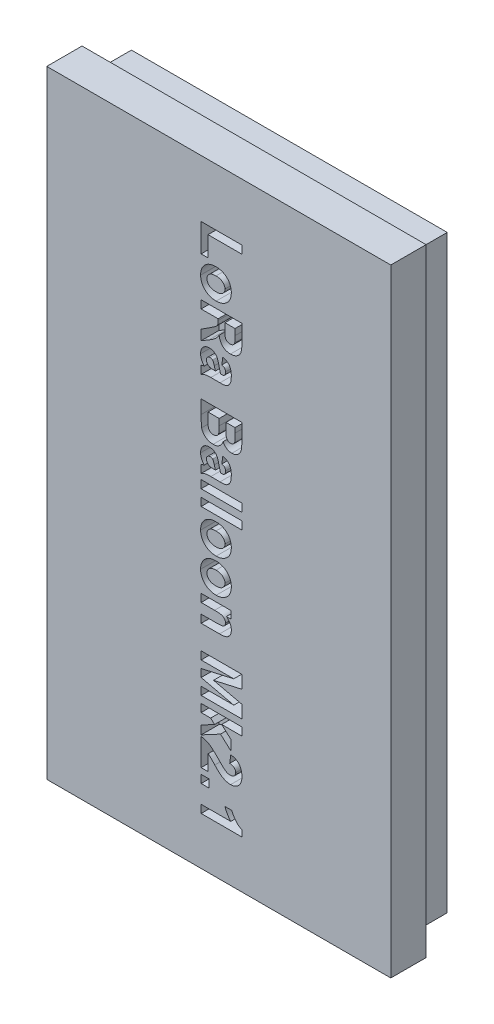
from build123d import *

# Parameters (mm, degrees)
SKETCH1_W           = 39
SKETCH1_H           = 70
BOSS_EXTRUDE1_DEPTH = 4
SKETCH2_W           = 35.8
SKETCH2_H           = 66.8
SKETCH2_W_2         = 32.2
SKETCH2_H_2         = 63.2
BOSS_EXTRUDE2_DEPTH = 4
SKETCH3_W           = 4.622973633
SKETCH3_H           = 0.90057928
SKETCH3_H_2         = 0.900579279
SKETCH3_W_2         = 0.900579279
CUT_EXTRUDE1_DEPTH  = 2


with BuildPart() as part:
    # Sketch1 → Boss-Extrude1 (new body)
    with BuildSketch(Plane.XY):
        with Locations((19.5, 35)):
            Rectangle(SKETCH1_W, SKETCH1_H)
    extrude(amount=BOSS_EXTRUDE1_DEPTH)

    # Sketch2 → Boss-Extrude2 (add)
    with BuildSketch(Plane(origin=(0, 0, 0), x_dir=(-1, 0, 0), z_dir=(0, 0, -1))):
        with Locations((-19.5, 35)):
            Rectangle(SKETCH2_W, SKETCH2_H)
        with Locations((-19.5, 35)):
            Rectangle(SKETCH2_W_2, SKETCH2_H_2, mode=Mode.SUBTRACT)
    extrude(amount=BOSS_EXTRUDE2_DEPTH)

    # Sketch3 → Cut-Extrude1 (cut)
    # profile 1 of 16: a face of its own
    with BuildSketch(Plane.XY.offset(4)):
        Polygon((17.5, 63.519691051), (22.122973633, 63.519691051), (22.122973633, 62.619111772), (18.280502042, 62.619111772), (18.280502042, 60.337644265), (17.5, 60.337644265), align=None)
    # profile 2 of 16: a face of its own
    with BuildSketch(Plane.XY.offset(4)):
        with BuildLine():
            add(Edge.make_bspline(
                [(19.227986492, 59.917373935), (19.268340591, 59.916553667), (19.348241235, 59.914929545), (19.466831788, 59.904980589), (19.582597294, 59.885571908), (19.695714536, 59.860482277), (19.806416527, 59.82895916), (19.913363069, 59.787668503), (20.018572563, 59.741561532), (20.119538873, 59.686551332), (20.216642118, 59.627238007), (20.307982668, 59.562480077), (20.392270804, 59.492505889), (20.471764649, 59.420003428), (20.542963196, 59.340819709), (20.610173753, 59.25914226), (20.668761487, 59.17106248), (20.722741328, 59.080281515), (20.769340893, 58.984958843), (20.810963092, 58.887212626), (20.84421655, 58.785501626), (20.874003462, 58.682243794), (20.895076066, 58.575124144), (20.911226693, 58.46559476), (20.920807626, 58.352789526), (20.921733394, 58.276648926), (20.922201261, 58.23816882)],
                knots=[0, 0, 0, 0, 1.087797627, 2.153826546, 3.204146119, 4.249074796, 5.276002369, 6.302929943, 7.33671768, 8.369955531, 9.399197913, 10.402506754, 11.384561342, 12.350717656, 13.299250364, 14.252266119, 15.199037181, 16.147307724, 17.097187567, 18.056740571, 19.008264324, 19.97962709, 20.951574749, 21.948063114, 22.962987564, 24, 24, 24, 24], degree=3))
            add(Edge.make_bspline(
                [(20.922201261, 58.23816882), (20.920492435, 58.17431076), (20.917163302, 58.049902547), (20.89380331, 57.868435741), (20.853287611, 57.69781183), (20.797267351, 57.536975467), (20.72326136, 57.38733444), (20.634810544, 57.247019053), (20.529143938, 57.117967528), (20.40795289, 57.001818049), (20.277240101, 56.897040623), (20.139130934, 56.806096419), (19.996080966, 56.728621147), (19.847473094, 56.665454644), (19.693540221, 56.615077456), (19.533372162, 56.581373883), (19.368435672, 56.5582934), (19.256523789, 56.556247491), (19.199843389, 56.555211293)],
                knots=[0, 0, 0, 0, 1.136040707, 2.213233445, 3.248238065, 4.25119704, 5.236487175, 6.211911138, 7.196384178, 8.195725979, 9.1931767, 10.173001403, 11.133846892, 12.083513917, 13.042376269, 14.010298635, 14.992269034, 16, 16, 16, 16], degree=3))
            add(Edge.make_bspline(
                [(19.199843389, 56.555211293), (19.157599655, 56.555892607), (19.0738988, 56.557242549), (18.949923499, 56.569225625), (18.828866965, 56.586435452), (18.710806659, 56.612233079), (18.595913097, 56.644512826), (18.484212787, 56.68553559), (18.375843769, 56.733219222), (18.270645012, 56.787374854), (18.171228883, 56.848385325), (18.076479739, 56.912829759), (17.989613644, 56.983498286), (17.908343846, 57.057930632), (17.833120613, 57.136653742), (17.764474284, 57.22039727), (17.702322369, 57.308790164), (17.647348245, 57.401571301), (17.598380596, 57.497418925), (17.556075444, 57.596143647), (17.52061437, 57.69714263), (17.49154767, 57.800282717), (17.4673821, 57.905319168), (17.452433072, 58.013337566), (17.441007522, 58.123164342), (17.440311587, 58.197173674), (17.439961381, 58.234416407)],
                knots=[0, 0, 0, 0, 1.117558833, 2.214307803, 3.293244786, 4.351421184, 5.409597582, 6.448807362, 7.497331125, 8.540978692, 9.576922014, 10.582241184, 11.570837346, 12.537122916, 13.496974449, 14.449450387, 15.399839374, 16.353464778, 17.300823134, 18.246083241, 19.193441597, 20.131138339, 21.080698472, 22.042616426, 23.015011865, 24, 24, 24, 24], degree=3))
            add(Edge.make_bspline(
                [(17.439961381, 58.234416407), (17.441434818, 58.293581477), (17.444329398, 58.409811804), (17.466190044, 58.580403837), (17.502637169, 58.743113282), (17.553836141, 58.89819662), (17.618260134, 59.046016275), (17.698440035, 59.185734774), (17.79447105, 59.316576164), (17.902499007, 59.440250702), (18.024251963, 59.553385074), (18.159878703, 59.651084335), (18.308067385, 59.733312239), (18.468125433, 59.800916368), (18.640780217, 59.853364958), (18.825794291, 59.890561403), (19.022910429, 59.913321598), (19.158504181, 59.916000953), (19.227986492, 59.917373935)],
                knots=[0, 0, 0, 0, 1.024594995, 2.012826322, 2.973358778, 3.908543225, 4.837401023, 5.761810751, 6.69243552, 7.644223827, 8.602462928, 9.564551743, 10.532007457, 11.531954493, 12.568505162, 13.651979317, 14.796803673, 16, 16, 16, 16], degree=3))
        make_face()
        with BuildLine():
            add(Edge.make_bspline(
                [(19.181081321, 59.016794656), (19.140418132, 59.015985767), (19.061457429, 59.014415049), (18.946509384, 59.004834622), (18.839622498, 58.985121553), (18.739486697, 58.962179728), (18.647961982, 58.928237045), (18.563118232, 58.889661344), (18.486368037, 58.842211129), (18.418159022, 58.787894592), (18.358227437, 58.728430958), (18.305063926, 58.666277416), (18.260023454, 58.601076499), (18.223835025, 58.532291004), (18.195763008, 58.46081815), (18.174765469, 58.386120438), (18.162389452, 58.308317825), (18.161082475, 58.255410656), (18.160424805, 58.228787786)],
                knots=[0, 0, 0, 0, 1.347985487, 2.617548842, 3.817114289, 4.948286482, 6.017057593, 7.046407217, 8.032969353, 8.999289909, 9.930051738, 10.827140183, 11.706817169, 12.550594062, 13.397420762, 14.247349517, 15.118066881, 16, 16, 16, 16], degree=3))
            add(Edge.make_bspline(
                [(18.160424805, 58.228787786), (18.161082172, 58.202789107), (18.162388524, 58.151123318), (18.174768649, 58.075184814), (18.195758212, 58.002347429), (18.224167513, 57.93213144), (18.260561859, 57.864498818), (18.306359128, 57.800600759), (18.359147439, 57.739085743), (18.42010437, 57.68129455), (18.488357165, 57.627164406), (18.565874129, 57.581398416), (18.650982245, 57.542984668), (18.743354127, 57.51120928), (18.843361939, 57.485665346), (18.951359004, 57.468256351), (19.067059726, 57.458032174), (19.146662829, 57.456552441), (19.187648045, 57.455790572)],
                knots=[0, 0, 0, 0, 0.86498205, 1.718932724, 2.552529207, 3.383717481, 4.236080589, 5.102502034, 5.995588818, 6.930639414, 7.894730959, 8.889086482, 9.918564038, 10.998334367, 12.1369617, 13.350269694, 14.635734454, 16, 16, 16, 16], degree=3))
            add(Edge.make_bspline(
                [(19.187648045, 57.455790572), (19.227688932, 57.456588782), (19.305407142, 57.458138086), (19.418448526, 57.467853118), (19.523973479, 57.487150925), (19.622320571, 57.511914829), (19.713524667, 57.543985128), (19.797316766, 57.58327715), (19.873991238, 57.630272105), (19.942107737, 57.685034462), (20.003044034, 57.743795675), (20.055828048, 57.806243808), (20.101619145, 57.87108965), (20.138009283, 57.939653741), (20.166408615, 58.010806032), (20.187393837, 58.084578407), (20.199774112, 58.161447567), (20.201080471, 58.21373417), (20.201737837, 58.240045027)],
                knots=[0, 0, 0, 0, 1.337232047, 2.595528913, 3.783536199, 4.915617704, 5.97906533, 7.006690339, 8.000659516, 8.974235141, 9.919454987, 10.823278711, 11.700968276, 12.565199868, 13.408680491, 14.254935835, 15.121875735, 16, 16, 16, 16], degree=3))
            add(Edge.make_bspline(
                [(20.201737837, 58.240045027), (20.201125638, 58.266363218), (20.199923414, 58.318046388), (20.187117275, 58.394207937), (20.1666105, 58.467170456), (20.137959369, 58.53762355), (20.10165055, 58.605310335), (20.055496899, 58.669222471), (20.003354012, 58.731596732), (19.942036507, 58.789412202), (19.873587127, 58.843503766), (19.796542842, 58.889985729), (19.712370979, 58.929796557), (19.620397249, 58.961484494), (19.521262796, 58.98667956), (19.414268616, 59.004448634), (19.300102491, 59.014500587), (19.221439565, 59.016016772), (19.181081321, 59.016794656)],
                knots=[0, 0, 0, 0, 0.8777483, 1.723705717, 2.56959874, 3.403036217, 4.257705828, 5.126471818, 6.029908573, 6.967489424, 7.934189811, 8.936630112, 9.963815147, 11.036651848, 12.178360317, 13.374360467, 14.652907978, 16, 16, 16, 16], degree=3))
        make_face(mode=Mode.SUBTRACT)
    # profile 3 of 16: a face of its own
    with BuildSketch(Plane.XY.offset(4)):
        with BuildLine():
            Line((17.5, 55.834747869), (22.122973633, 55.834747869))
            Line((22.122973633, 55.834747869), (22.122973633, 53.931336039))
            add(Edge.make_bspline(
                [(22.122973633, 53.931336039), (22.122603462, 53.872546069), (22.121890503, 53.759314846), (22.116763364, 53.595968956), (22.105883787, 53.445890968), (22.093695487, 53.308683291), (22.075788291, 53.184747794), (22.054389036, 53.07355638), (22.02973767, 52.975250916), (21.991190656, 52.86232027), (21.927918547, 52.73590191), (21.829831137, 52.599074998), (21.709116511, 52.475953385), (21.591346034, 52.386968918), (21.487257539, 52.325280846), (21.404923358, 52.283439484), (21.317857299, 52.250098354), (21.227356033, 52.221689731), (21.133020602, 52.199279165), (21.034598303, 52.183293809), (20.932711672, 52.173783072), (20.863433738, 52.17285937), (20.828390919, 52.172392134)],
                knots=[0, 0, 0, 0, 1.403336213, 2.702867097, 3.89994726, 4.994709233, 5.990128961, 6.887471613, 7.696701944, 8.407207329, 9.732421867, 11.053910544, 12.410433107, 13.833109191, 14.562763883, 15.297137368, 16.03453921, 16.78526912, 17.560138056, 18.346710252, 19.163717375, 20, 20, 20, 20], degree=3))
            add(Edge.make_bspline(
                [(20.828390919, 52.172392134), (20.784249276, 52.173152122), (20.697885971, 52.17463904), (20.571821786, 52.19038499), (20.45195708, 52.21403639), (20.339297604, 52.249508681), (20.231984451, 52.291952276), (20.132497639, 52.347135765), (20.039105913, 52.411113631), (19.952432097, 52.48444969), (19.87351831, 52.567423037), (19.802330467, 52.658794234), (19.737810759, 52.757581763), (19.682936532, 52.865615406), (19.633581682, 52.98093702), (19.593807931, 53.105487545), (19.560681473, 53.237717693), (19.545373295, 53.32925955), (19.537560619, 53.375978817)],
                knots=[0, 0, 0, 0, 1.084141299, 2.12112686, 3.117250271, 4.082180618, 5.019674211, 5.948149429, 6.871043381, 7.797863675, 8.732676681, 9.679570512, 10.640822351, 11.627176691, 12.653315453, 13.72007994, 14.836420889, 16, 16, 16, 16], degree=3))
            add(Edge.make_bspline(
                [(19.537560619, 53.375978817), (19.508484087, 53.327420021), (19.451853997, 53.232845847), (19.358336472, 53.100939278), (19.261317569, 52.981707751), (19.174212653, 52.890871561), (19.097310292, 52.821625001), (19.0295238, 52.766448195), (18.951540268, 52.707420675), (18.862838653, 52.644481945), (18.763722605, 52.577189453), (18.653874446, 52.505987708), (18.533375015, 52.430769254), (18.449117336, 52.379912075), (18.405269796, 52.353446093)],
                knots=[0, 0, 0, 0, 1.316447784, 2.563942512, 3.758196669, 4.89017242, 5.487731481, 6.164970468, 6.923081098, 7.76291089, 8.695186333, 9.710230341, 10.808408125, 12, 12, 12, 12], degree=3))
            Line((18.405269796, 52.353446093), (17.5, 51.812160423))
            Line((17.5, 51.812160423), (17.5, 52.95383228))
            Line((17.5, 52.95383228), (18.495327724, 53.594556913))
            add(Edge.make_bspline(
                [(18.495327724, 53.594556913), (18.538170903, 53.622381996), (18.619855584, 53.675433219), (18.736113095, 53.751052306), (18.839709613, 53.820173631), (18.931509766, 53.880939595), (19.009413932, 53.937271757), (19.075916224, 53.984397728), (19.12987976, 54.024862821), (19.184272621, 54.068912267), (19.238866246, 54.121356183), (19.293796286, 54.18457256), (19.336920929, 54.250578408), (19.370530988, 54.321019242), (19.39451614, 54.403545626), (19.410428062, 54.503019432), (19.418952624, 54.622883951), (19.420435996, 54.709323008), (19.421235795, 54.755928941)],
                knots=[0, 0, 0, 0, 1.540630534, 2.937361724, 4.182336204, 5.296545873, 6.256860607, 7.081241145, 7.754565199, 8.290682583, 9.191113071, 10.033949391, 10.810788607, 11.561665679, 12.379113064, 13.39303176, 14.594383257, 16, 16, 16, 16], degree=3))
            Line((19.421235795, 54.755928941), (19.421235795, 54.93416859))
            Line((19.421235795, 54.93416859), (17.5, 54.93416859))
            Line((17.5, 54.93416859), (17.5, 55.834747869))
        make_face()
        with BuildLine():
            Line((20.201737837, 54.93416859), (20.201737837, 54.273743786))
            add(Edge.make_bspline(
                [(20.201737837, 54.273743786), (20.201999563, 54.225587847), (20.20249754, 54.133962899), (20.203997976, 54.003230593), (20.207918581, 53.886279269), (20.212519213, 53.783074596), (20.217812844, 53.693574506), (20.224943188, 53.617787775), (20.23420104, 53.555806365), (20.24734485, 53.49201719), (20.271407064, 53.424655662), (20.311858966, 53.353327902), (20.361639607, 53.288286701), (20.424349944, 53.232785424), (20.498156922, 53.186888836), (20.583996569, 53.155374934), (20.680596319, 53.136459226), (20.748558268, 53.134198807), (20.784300059, 53.133010032)],
                knots=[0, 0, 0, 0, 1.560937284, 2.96995135, 4.237567709, 5.353650601, 6.318464703, 7.143454388, 7.820048429, 8.348858403, 9.25293029, 10.124191563, 10.998043079, 11.895328271, 12.823620657, 13.798761283, 14.842349086, 16, 16, 16, 16], degree=3))
            add(Edge.make_bspline(
                [(20.784300059, 53.133010032), (20.81847221, 53.134245883), (20.883936766, 53.136613436), (20.976941065, 53.155158092), (21.059506611, 53.187182262), (21.130758936, 53.23301968), (21.191421011, 53.289971409), (21.24112854, 53.356768373), (21.282982152, 53.431399448), (21.299994907, 53.486582477), (21.308699868, 53.514818122)],
                knots=[0, 0, 0, 0, 1.164311867, 2.230505154, 3.21629184, 4.165493112, 5.100643873, 6.036584124, 6.995373831, 8, 8, 8, 8], degree=3))
            add(Edge.make_bspline(
                [(21.308699868, 53.514818122), (21.311320199, 53.527617067), (21.317551044, 53.558051486), (21.324877556, 53.611570435), (21.329832618, 53.679873062), (21.334583807, 53.762748434), (21.338086886, 53.860333551), (21.341182461, 53.972906446), (21.341427788, 54.100196665), (21.342111742, 54.189940649), (21.342471591, 54.237157752)],
                knots=[0, 0, 0, 0, 0.432971861, 1.029557334, 1.788740938, 2.702316591, 3.781055348, 5.025222918, 6.434877167, 8, 8, 8, 8], degree=3))
            Line((21.342471591, 54.237157752), (21.342471591, 54.93416859))
            Line((21.342471591, 54.93416859), (20.201737837, 54.93416859))
        make_face(mode=Mode.SUBTRACT)
    # profile 4 of 16: a face of its own
    with BuildSketch(Plane.XY.offset(4)):
        with BuildLine():
            Line((19.841506126, 50.61138805), (19.961583363, 51.451928711))
            add(Edge.make_bspline(
                [(19.961583363, 51.451928711), (20.003056427, 51.440020111), (20.08373433, 51.416854211), (20.198162111, 51.373136266), (20.30438426, 51.325709527), (20.401073835, 51.270902191), (20.489620864, 51.211489282), (20.568113139, 51.144980211), (20.637964286, 51.07344571), (20.699606916, 50.99601388), (20.752828321, 50.910954703), (20.798705368, 50.817942481), (20.837141958, 50.716108782), (20.867740873, 50.60578658), (20.892075182, 50.486988816), (20.909807303, 50.359486045), (20.919932697, 50.223177629), (20.921430674, 50.129532389), (20.922201261, 50.081359621)],
                knots=[0, 0, 0, 0, 1.125515524, 2.189474865, 3.193709533, 4.158305409, 5.086274303, 5.972285183, 6.837881566, 7.691743787, 8.549806887, 9.451203831, 10.393874208, 11.385866739, 12.435713252, 13.556277782, 14.742906037, 16, 16, 16, 16], degree=3))
            add(Edge.make_bspline(
                [(20.922201261, 50.081359621), (20.921986052, 50.038506543), (20.921567926, 49.9552477), (20.914195236, 49.834230246), (20.905701633, 49.720830457), (20.891648419, 49.615270623), (20.872802431, 49.517635474), (20.850656262, 49.42762641), (20.824366297, 49.345482), (20.785361186, 49.248588079), (20.72686919, 49.141789781), (20.645227411, 49.029792983), (20.550150903, 48.93865795), (20.460504459, 48.877402987), (20.378336951, 48.83955966), (20.305144759, 48.816000272), (20.220833774, 48.79526852), (20.12519058, 48.778860098), (20.01811083, 48.765903154), (19.899799318, 48.756781831), (19.770265296, 48.75115149), (19.680158536, 48.750519763), (19.633247167, 48.750190874)],
                knots=[0, 0, 0, 0, 1.172645795, 2.278322549, 3.317437237, 4.284552983, 5.190951134, 6.037858116, 6.820064311, 7.549551753, 8.893788561, 10.141635195, 11.328036199, 12.481663495, 13.094362176, 13.79803918, 14.582676335, 15.469136844, 16.45214095, 17.533908717, 18.716103928, 20, 20, 20, 20], degree=3))
            Line((19.633247167, 48.750190874), (18.599457203, 48.757695701))
            add(Edge.make_bspline(
                [(18.599457203, 48.757695701), (18.564435728, 48.757403719), (18.496576972, 48.756837966), (18.398330909, 48.755681196), (18.307040045, 48.750474743), (18.222621106, 48.744792865), (18.144878475, 48.739106667), (18.074326469, 48.729015709), (18.010639761, 48.719369923), (17.934153527, 48.702680168), (17.841504636, 48.67487694), (17.729923806, 48.631472915), (17.614669352, 48.576902525), (17.539082625, 48.532826305), (17.5, 48.510036399)],
                knots=[0, 0, 0, 0, 1.100960395, 2.13325684, 3.08799504, 3.974623839, 4.793377983, 5.537123068, 6.214225653, 6.817686965, 7.996461938, 9.250537039, 10.578371695, 12, 12, 12, 12], degree=3))
            Line((17.5, 48.510036399), (17.5, 49.410615678))
            Line((17.5, 49.410615678), (17.867736539, 49.520373778))
            add(Edge.make_bspline(
                [(17.867736539, 49.520373778), (17.83226304, 49.556591272), (17.763238807, 49.627063168), (17.674416477, 49.742170854), (17.599695505, 49.860344522), (17.540260444, 49.983200312), (17.494849843, 50.10999856), (17.463178517, 50.240511108), (17.443827041, 50.375032633), (17.441261018, 50.465917722), (17.439961381, 50.511949088)],
                knots=[0, 0, 0, 0, 1.094238684, 2.129166538, 3.133671034, 4.10942336, 5.070833053, 6.037377746, 7.005973528, 8, 8, 8, 8], degree=3))
            add(Edge.make_bspline(
                [(17.439961381, 50.511949088), (17.441007341, 50.549813025), (17.443061457, 50.624172367), (17.454903777, 50.733206179), (17.476538098, 50.836821689), (17.507054288, 50.934832823), (17.543951561, 51.028430924), (17.591661801, 51.116031558), (17.646964549, 51.198837941), (17.71053094, 51.275834447), (17.781922723, 51.344520407), (17.857738316, 51.406912183), (17.941277911, 51.456774609), (18.028844016, 51.500371802), (18.123266364, 51.531264195), (18.222597532, 51.555303125), (18.327631273, 51.569376344), (18.399600412, 51.571119046), (18.436227209, 51.572005948)],
                knots=[0, 0, 0, 0, 1.111028414, 2.181900458, 3.212888925, 4.21115239, 5.190734394, 6.159429897, 7.131421471, 8.108723925, 9.081883785, 10.034678926, 10.981892532, 11.929727932, 12.898727489, 13.888948844, 14.925636122, 16, 16, 16, 16], degree=3))
            add(Edge.make_bspline(
                [(18.436227209, 51.572005948), (18.482593242, 51.570570747), (18.572724924, 51.567780835), (18.703283791, 51.545991429), (18.824622959, 51.509589158), (18.936022841, 51.457337912), (19.037479655, 51.39257465), (19.129142785, 51.315722556), (19.208842276, 51.225745591), (19.267148448, 51.141322735), (19.309753926, 51.065822541), (19.338835724, 50.999600706), (19.369441505, 50.926842835), (19.396985309, 50.845322297), (19.425368881, 50.756348095), (19.452494502, 50.659084561), (19.4774731, 50.553428176), (19.493569489, 50.48038811), (19.501912689, 50.442529436)],
                knots=[0, 0, 0, 0, 1.294162278, 2.515743014, 3.684113667, 4.820865117, 5.939906549, 7.036651616, 8.149715676, 9.285662014, 9.895437351, 10.567486448, 11.303637924, 12.098932185, 12.968810962, 13.91153998, 14.917493754, 16, 16, 16, 16], degree=3))
            add(Edge.make_bspline(
                [(19.501912689, 50.442529436), (19.511407002, 50.396831191), (19.529650374, 50.309021778), (19.559131352, 50.183149311), (19.587017816, 50.068002884), (19.61413993, 49.963436659), (19.640930358, 49.869757609), (19.668501435, 49.787074691), (19.694085633, 49.714833804), (19.712787099, 49.671017361), (19.721428888, 49.650770153)],
                knots=[0, 0, 0, 0, 1.361164628, 2.615484881, 3.770095419, 4.816364149, 5.765912261, 6.610903979, 7.358110453, 8, 8, 8, 8], degree=3))
            add(Edge.make_bspline(
                [(19.721428888, 49.650770153), (19.76207844, 49.651429427), (19.835936364, 49.652627291), (19.93546068, 49.657961407), (20.012171286, 49.66950181), (20.070146149, 49.685642352), (20.113156329, 49.712229682), (20.150196809, 49.74408205), (20.18179134, 49.785492699), (20.210776693, 49.83420177), (20.234039299, 49.892955807), (20.250744994, 49.962036374), (20.259418855, 50.041742371), (20.260957962, 50.098226609), (20.261776456, 50.128264791)],
                knots=[0, 0, 0, 0, 1.704637254, 3.09722893, 4.172654963, 4.956246112, 5.596985007, 6.275246559, 6.99385986, 7.769515704, 8.645866914, 9.631493719, 10.740434052, 12, 12, 12, 12], degree=3))
            add(Edge.make_bspline(
                [(20.261776456, 50.128264791), (20.260884607, 50.159017067), (20.25919465, 50.217289276), (20.241526382, 50.299374461), (20.215410217, 50.372126763), (20.174002857, 50.43472478), (20.117664666, 50.489569205), (20.042764104, 50.536922131), (19.949087652, 50.578793394), (19.879011929, 50.60002468), (19.841506126, 50.61138805)],
                knots=[0, 0, 0, 0, 1.045871977, 1.981813381, 2.848317391, 3.663751395, 4.514929533, 5.507645304, 6.666046366, 8, 8, 8, 8], degree=3))
        make_face()
        with BuildLine():
            add(Edge.make_bspline(
                [(19.121042702, 49.650770153), (19.111478433, 49.678227344), (19.090198568, 49.739317777), (19.059474829, 49.841940313), (19.027018533, 49.965053874), (19.005193715, 50.054117219), (18.993460638, 50.101997896)],
                knots=[0, 0, 0, 0, 0.743632693, 1.654533494, 2.73907137, 4, 4, 4, 4], degree=3))
            add(Edge.make_bspline(
                [(18.993460638, 50.101997896), (18.98653897, 50.130215888), (18.97332241, 50.184096661), (18.950053418, 50.260430744), (18.928514853, 50.329717913), (18.904326783, 50.390991339), (18.881777826, 50.445420249), (18.857166421, 50.491799098), (18.832210074, 50.530622659), (18.813567384, 50.552457403), (18.804901851, 50.562606673)],
                knots=[0, 0, 0, 0, 1.388607462, 2.65147299, 3.814389992, 4.855436495, 5.799565367, 6.62877246, 7.362623276, 8, 8, 8, 8], degree=3))
            add(Edge.make_bspline(
                [(18.804901851, 50.562606673), (18.787150786, 50.579491216), (18.752087496, 50.612842884), (18.686643373, 50.646727282), (18.614581201, 50.668200293), (18.563658271, 50.670332939), (18.537542378, 50.671426669)],
                knots=[0, 0, 0, 0, 0.985740837, 1.947112291, 2.947173789, 4, 4, 4, 4], degree=3))
            add(Edge.make_bspline(
                [(18.537542378, 50.671426669), (18.50766342, 50.670137856), (18.449801672, 50.667642019), (18.366786442, 50.643682117), (18.290760217, 50.606342092), (18.224593068, 50.553149627), (18.168585191, 50.490429239), (18.129814521, 50.416483471), (18.103890852, 50.33606052), (18.101569181, 50.279194172), (18.100386186, 50.250218235)],
                knots=[0, 0, 0, 0, 1.056198986, 2.045369905, 3.036276429, 4.038084886, 5.035473036, 5.992159802, 6.976916006, 8, 8, 8, 8], degree=3))
            add(Edge.make_bspline(
                [(18.100386186, 50.250218235), (18.101736527, 50.223223501), (18.104453435, 50.16890965), (18.124157539, 50.087854462), (18.156784545, 50.007731894), (18.200051148, 49.929484378), (18.252073425, 49.8576195), (18.311090427, 49.79663157), (18.374225547, 49.747093123), (18.432190619, 49.715163813), (18.484079963, 49.69628429), (18.530121172, 49.684823766), (18.5827991, 49.672932093), (18.642798398, 49.665245914), (18.709733915, 49.658557856), (18.78390109, 49.654068826), (18.865230729, 49.651253864), (18.921849407, 49.650935466), (18.951245984, 49.650770153)],
                knots=[0, 0, 0, 0, 1.093500888, 2.200141778, 3.360346716, 4.591280596, 5.815607582, 6.94487563, 8.019710678, 9.057444999, 9.610729159, 10.253199895, 10.979011171, 11.798077413, 12.702238226, 13.705425431, 14.808650418, 16, 16, 16, 16], degree=3))
            Line((18.951245984, 49.650770153), (19.121042702, 49.650770153))
        make_face(mode=Mode.SUBTRACT)
    # profile 5 of 16: a face of its own
    with BuildSketch(Plane.XY.offset(4)):
        with BuildLine():
            Line((22.122973633, 46.108491655), (22.122973633, 44.281066201))
            add(Edge.make_bspline(
                [(22.122973633, 44.281066201), (22.122521051, 44.221026579), (22.121651102, 44.105618856), (22.117632998, 43.939162972), (22.108005759, 43.786847256), (22.095757541, 43.648294778), (22.081840746, 43.523482495), (22.061533426, 43.412540908), (22.040180572, 43.315039471), (22.0049456, 43.204537428), (21.948462842, 43.080188598), (21.859088002, 42.944827325), (21.748544411, 42.821243994), (21.640427701, 42.730695394), (21.545807025, 42.665898527), (21.471963858, 42.622291391), (21.394724771, 42.586831753), (21.315529677, 42.557950869), (21.2346417, 42.533594529), (21.150572045, 42.51855641), (21.064475175, 42.507225139), (21.006044505, 42.506526476), (20.976611259, 42.506174538)],
                knots=[0, 0, 0, 0, 1.498327689, 2.88007457, 4.154414764, 5.305986542, 6.351317343, 7.286582663, 8.11946184, 8.840080679, 10.177555878, 11.512935148, 12.872513647, 14.301275782, 15.019863751, 15.733221227, 16.438466007, 17.137161526, 17.836031326, 18.543086972, 19.26611006, 20, 20, 20, 20], degree=3))
            add(Edge.make_bspline(
                [(20.976611259, 42.506174538), (20.922946761, 42.508244761), (20.817024149, 42.512330951), (20.662821857, 42.547652419), (20.51596526, 42.603079791), (20.380113254, 42.682270405), (20.256588311, 42.778484715), (20.148778926, 42.889289753), (20.056681459, 43.012718845), (20.011500867, 43.104508485), (19.988788362, 43.150651585)],
                knots=[0, 0, 0, 0, 1.031817477, 2.036594177, 3.029254201, 4.043130586, 5.050931669, 6.034203586, 7.01178454, 8, 8, 8, 8], degree=3))
            add(Edge.make_bspline(
                [(19.988788362, 43.150651585), (19.978291223, 43.119218071), (19.957542489, 43.057086323), (19.919057509, 42.967929238), (19.874445181, 42.88431553), (19.826159834, 42.80476423), (19.770442173, 42.731859613), (19.709973461, 42.664103109), (19.645321829, 42.600321355), (19.573797837, 42.544037104), (19.499063042, 42.491579361), (19.418797393, 42.447838091), (19.335071516, 42.410185621), (19.247401209, 42.378753037), (19.155229507, 42.355750252), (19.059306459, 42.33888402), (18.959608937, 42.328333414), (18.891858621, 42.326825057), (18.857435643, 42.326058683)],
                knots=[0, 0, 0, 0, 1.053917501, 2.08318216, 3.084375989, 4.067115349, 5.039987852, 5.998256831, 6.954975631, 7.924383767, 8.890110205, 9.856297623, 10.826929889, 11.808561028, 12.814635272, 13.844956918, 14.905053061, 16, 16, 16, 16], degree=3))
            add(Edge.make_bspline(
                [(18.857435643, 42.326058683), (18.815500063, 42.327003794), (18.733295748, 42.328856452), (18.612472135, 42.342119765), (18.496620731, 42.364499356), (18.385911071, 42.396523304), (18.279951486, 42.436913818), (18.179119697, 42.486864589), (18.083315073, 42.546315283), (17.992730779, 42.613589789), (17.90919217, 42.686948542), (17.833589227, 42.76465437), (17.765489185, 42.844869725), (17.707581308, 42.930073546), (17.656528591, 43.017258222), (17.61374927, 43.107736452), (17.581005615, 43.201992388), (17.565164633, 43.26652488), (17.557224308, 43.298871925)],
                knots=[0, 0, 0, 0, 1.145607172, 2.24567906, 3.316329682, 4.365460088, 5.390414304, 6.410550385, 7.434792233, 8.46684308, 9.489944109, 10.468671886, 11.426900475, 12.36059261, 13.279351643, 14.185149476, 15.09030244, 16, 16, 16, 16], degree=3))
            add(Edge.make_bspline(
                [(17.557224308, 43.298871925), (17.552629506, 43.325417983), (17.542179673, 43.385790953), (17.530238938, 43.48844883), (17.521967062, 43.613706564), (17.512784829, 43.761568824), (17.508239794, 43.932081832), (17.503113461, 44.125314849), (17.500511164, 44.34109826), (17.500175925, 44.492451827), (17.5, 44.57187826)],
                knots=[0, 0, 0, 0, 0.506837559, 1.152686718, 1.943271314, 2.868501158, 3.939884368, 5.152247396, 6.505573166, 8, 8, 8, 8], degree=3))
            Line((17.5, 44.57187826), (17.5, 46.108491655))
            Line((17.5, 46.108491655), (22.122973633, 46.108491655))
        make_face()
        with BuildLine():
            Line((21.342471591, 45.207912376), (20.321815075, 45.207912376))
            Line((20.321815075, 45.207912376), (20.321815075, 44.594392742))
            add(Edge.make_bspline(
                [(20.321815075, 44.594392742), (20.321708304, 44.55061401), (20.321505436, 44.467433178), (20.322860414, 44.349236777), (20.323271951, 44.244155796), (20.325612076, 44.152236417), (20.326868369, 44.073713296), (20.330184865, 44.008391975), (20.332255296, 43.956085536), (20.33545221, 43.925515906), (20.336824729, 43.912391559)],
                knots=[0, 0, 0, 0, 1.539755574, 2.925579234, 4.157432792, 5.235486124, 6.159601295, 6.919197766, 7.535983151, 8, 8, 8, 8], degree=3))
            add(Edge.make_bspline(
                [(20.336824729, 43.912391559), (20.342990913, 43.874641455), (20.354742688, 43.802695703), (20.388025395, 43.701846174), (20.433788831, 43.614182948), (20.491801151, 43.538937987), (20.562445267, 43.478974229), (20.646094328, 43.436974564), (20.740542137, 43.410987644), (20.807575483, 43.408203042), (20.84246247, 43.406753817)],
                knots=[0, 0, 0, 0, 1.156043088, 2.203236031, 3.197816213, 4.134692963, 5.061434266, 5.975433912, 6.946330216, 8, 8, 8, 8], degree=3))
            add(Edge.make_bspline(
                [(20.84246247, 43.406753817), (20.873876263, 43.407765583), (20.934019538, 43.409702659), (21.019351721, 43.431386426), (21.096016804, 43.464879192), (21.161935885, 43.513564177), (21.216357618, 43.571749905), (21.262093272, 43.635170819), (21.293723027, 43.705544152), (21.3117268, 43.770575939), (21.321477076, 43.833977643), (21.325841476, 43.900183126), (21.332380205, 43.98452942), (21.334869957, 44.08688744), (21.339580253, 44.207545593), (21.340377663, 44.346113349), (21.343094236, 44.5027625), (21.342686451, 44.613153063), (21.342471591, 44.671317222)],
                knots=[0, 0, 0, 0, 0.973031789, 1.862917975, 2.714444411, 3.555113712, 4.385861934, 5.180259999, 5.970734499, 6.766732084, 7.267820327, 7.959442945, 8.825288207, 9.893716152, 11.136763095, 12.573466007, 14.194578749, 16, 16, 16, 16], degree=3))
            Line((21.342471591, 44.671317222), (21.342471591, 45.207912376))
        make_face(mode=Mode.SUBTRACT)
        with BuildLine():
            Line((19.541313033, 45.207912376), (18.280502042, 45.207912376))
            Line((18.280502042, 45.207912376), (18.280502042, 44.367371715))
            add(Edge.make_bspline(
                [(18.280502042, 44.367371715), (18.280760428, 44.323280795), (18.281253401, 44.239160195), (18.282800025, 44.11937151), (18.286518536, 44.01209175), (18.291887116, 43.916971468), (18.299557696, 43.834126401), (18.307251331, 43.763556455), (18.317857629, 43.70572466), (18.331738252, 43.644979433), (18.35944942, 43.580071948), (18.402845831, 43.510176577), (18.458232543, 43.446158643), (18.525607831, 43.390276991), (18.604204685, 43.343759319), (18.693207476, 43.30987147), (18.79246554, 43.290066164), (18.861720576, 43.287837041), (18.897774089, 43.28667658)],
                knots=[0, 0, 0, 0, 1.468823539, 2.802352852, 3.990613231, 5.044577628, 5.97542194, 6.762296442, 7.407977832, 7.933490854, 8.834961323, 9.742609811, 10.665728169, 11.642033707, 12.646065455, 13.694610711, 14.799836276, 16, 16, 16, 16], degree=3))
            add(Edge.make_bspline(
                [(18.897774089, 43.28667658), (18.93476601, 43.288172532), (19.005924698, 43.291050187), (19.107872413, 43.311463924), (19.199388257, 43.34738452), (19.279963622, 43.397906582), (19.349625379, 43.459908308), (19.407243483, 43.532310286), (19.454309014, 43.613210713), (19.482516024, 43.689669667), (19.49973763, 43.760283467), (19.510234486, 43.826232908), (19.521102124, 43.904014), (19.527554048, 43.994593036), (19.534829997, 44.097100853), (19.5376358, 44.212266537), (19.540957195, 44.339522346), (19.541190876, 44.42865785), (19.541313033, 44.475253608)],
                knots=[0, 0, 0, 0, 1.143215143, 2.19912046, 3.197116365, 4.165365694, 5.123819291, 6.065802965, 7.014162653, 8.005206416, 8.5725482, 9.259043701, 10.068343003, 10.999502645, 12.064921609, 13.244816419, 14.559722402, 16, 16, 16, 16], degree=3))
            Line((19.541313033, 44.475253608), (19.541313033, 45.207912376))
        make_face(mode=Mode.SUBTRACT)
    # profile 6 of 16: a face of its own
    with BuildSketch(Plane.XY.offset(4)):
        with BuildLine():
            Line((19.841506126, 40.885131836), (19.961583363, 41.725672496))
            add(Edge.make_bspline(
                [(19.961583363, 41.725672496), (20.003056427, 41.713763896), (20.08373433, 41.690597996), (20.198162111, 41.646880052), (20.30438426, 41.599453313), (20.401073835, 41.544645976), (20.489620864, 41.485233068), (20.568113139, 41.418723997), (20.637964286, 41.347189496), (20.699606916, 41.269757665), (20.752828321, 41.184698488), (20.798705368, 41.091686266), (20.837141958, 40.989852568), (20.867740873, 40.879530366), (20.892075182, 40.760732601), (20.909807303, 40.633229831), (20.919932697, 40.496921414), (20.921430674, 40.403276175), (20.922201261, 40.355103406)],
                knots=[0, 0, 0, 0, 1.125515524, 2.189474865, 3.193709533, 4.158305409, 5.086274303, 5.972285183, 6.837881566, 7.691743787, 8.549806887, 9.451203831, 10.393874208, 11.385866739, 12.435713252, 13.556277782, 14.742906037, 16, 16, 16, 16], degree=3))
            add(Edge.make_bspline(
                [(20.922201261, 40.355103406), (20.921986052, 40.312250329), (20.921567926, 40.228991485), (20.914195236, 40.107974031), (20.905701633, 39.994574243), (20.891648419, 39.889014409), (20.872802431, 39.79137926), (20.850656262, 39.701370195), (20.824366297, 39.619225785), (20.785361186, 39.522331864), (20.72686919, 39.415533566), (20.645227411, 39.303536769), (20.550150903, 39.212401735), (20.460504459, 39.151146773), (20.378336951, 39.113303446), (20.305144759, 39.089744058), (20.220833774, 39.069012306), (20.12519058, 39.052603883), (20.01811083, 39.039646939), (19.899799318, 39.030525616), (19.770265296, 39.024895276), (19.680158536, 39.024263549), (19.633247167, 39.023934659)],
                knots=[0, 0, 0, 0, 1.172645795, 2.278322549, 3.317437237, 4.284552983, 5.190951134, 6.037858116, 6.820064311, 7.549551753, 8.893788561, 10.141635195, 11.328036199, 12.481663495, 13.094362176, 13.79803918, 14.582676335, 15.469136844, 16.45214095, 17.533908717, 18.716103928, 20, 20, 20, 20], degree=3))
            Line((19.633247167, 39.023934659), (18.599457203, 39.031439486))
            add(Edge.make_bspline(
                [(18.599457203, 39.031439486), (18.564435728, 39.031147505), (18.496576972, 39.030581752), (18.398330909, 39.029424982), (18.307040045, 39.024218529), (18.222621106, 39.01853665), (18.144878475, 39.012850452), (18.074326469, 39.002759494), (18.010639761, 38.993113708), (17.934153527, 38.976423954), (17.841504636, 38.948620726), (17.729923806, 38.9052167), (17.614669352, 38.85064631), (17.539082625, 38.80657009), (17.5, 38.783780185)],
                knots=[0, 0, 0, 0, 1.100960395, 2.13325684, 3.08799504, 3.974623839, 4.793377983, 5.537123068, 6.214225653, 6.817686965, 7.996461938, 9.250537039, 10.578371695, 12, 12, 12, 12], degree=3))
            Line((17.5, 38.783780185), (17.5, 39.684359464))
            Line((17.5, 39.684359464), (17.867736539, 39.794117563))
            add(Edge.make_bspline(
                [(17.867736539, 39.794117563), (17.83226304, 39.830335057), (17.763238807, 39.900806954), (17.674416477, 40.015914639), (17.599695505, 40.134088308), (17.540260444, 40.256944098), (17.494849843, 40.383742345), (17.463178517, 40.514254893), (17.443827041, 40.648776419), (17.441261018, 40.739661508), (17.439961381, 40.785692874)],
                knots=[0, 0, 0, 0, 1.094238684, 2.129166538, 3.133671034, 4.10942336, 5.070833053, 6.037377746, 7.005973528, 8, 8, 8, 8], degree=3))
            add(Edge.make_bspline(
                [(17.439961381, 40.785692874), (17.441007341, 40.823556811), (17.443061457, 40.897916153), (17.454903777, 41.006949964), (17.476538098, 41.110565475), (17.507054288, 41.208576608), (17.543951561, 41.30217471), (17.591661801, 41.389775344), (17.646964549, 41.472581727), (17.71053094, 41.549578232), (17.781922723, 41.618264192), (17.857738316, 41.680655968), (17.941277911, 41.730518394), (18.028844016, 41.774115587), (18.123266364, 41.80500798), (18.222597532, 41.82904691), (18.327631273, 41.84312013), (18.399600412, 41.844862831), (18.436227209, 41.845749734)],
                knots=[0, 0, 0, 0, 1.111028414, 2.181900458, 3.212888925, 4.21115239, 5.190734394, 6.159429897, 7.131421471, 8.108723925, 9.081883785, 10.034678926, 10.981892532, 11.929727932, 12.898727489, 13.888948844, 14.925636122, 16, 16, 16, 16], degree=3))
            add(Edge.make_bspline(
                [(18.436227209, 41.845749734), (18.482593242, 41.844314532), (18.572724924, 41.841524621), (18.703283791, 41.819735215), (18.824622959, 41.783332943), (18.936022841, 41.731081698), (19.037479655, 41.666318435), (19.129142785, 41.589466341), (19.208842276, 41.499489376), (19.267148448, 41.41506652), (19.309753926, 41.339566327), (19.338835724, 41.273344491), (19.369441505, 41.20058662), (19.396985309, 41.119066083), (19.425368881, 41.030091881), (19.452494502, 40.932828347), (19.4774731, 40.827171961), (19.493569489, 40.754131895), (19.501912689, 40.716273221)],
                knots=[0, 0, 0, 0, 1.294162278, 2.515743014, 3.684113667, 4.820865117, 5.939906549, 7.036651616, 8.149715676, 9.285662014, 9.895437351, 10.567486448, 11.303637924, 12.098932185, 12.968810962, 13.91153998, 14.917493754, 16, 16, 16, 16], degree=3))
            add(Edge.make_bspline(
                [(19.501912689, 40.716273221), (19.511407002, 40.670574977), (19.529650374, 40.582765564), (19.559131352, 40.456893096), (19.587017816, 40.341746669), (19.61413993, 40.237180445), (19.640930358, 40.143501395), (19.668501435, 40.060818476), (19.694085633, 39.988577589), (19.712787099, 39.944761147), (19.721428888, 39.924513938)],
                knots=[0, 0, 0, 0, 1.361164628, 2.615484881, 3.770095419, 4.816364149, 5.765912261, 6.610903979, 7.358110453, 8, 8, 8, 8], degree=3))
            add(Edge.make_bspline(
                [(19.721428888, 39.924513938), (19.76207844, 39.925173213), (19.835936364, 39.926371077), (19.93546068, 39.931705192), (20.012171286, 39.943245596), (20.070146149, 39.959386137), (20.113156329, 39.985973467), (20.150196809, 40.017825836), (20.18179134, 40.059236484), (20.210776693, 40.107945555), (20.234039299, 40.166699593), (20.250744994, 40.23578016), (20.259418855, 40.315486157), (20.260957962, 40.371970395), (20.261776456, 40.402008577)],
                knots=[0, 0, 0, 0, 1.704637254, 3.09722893, 4.172654963, 4.956246112, 5.596985007, 6.275246559, 6.99385986, 7.769515704, 8.645866914, 9.631493719, 10.740434052, 12, 12, 12, 12], degree=3))
            add(Edge.make_bspline(
                [(20.261776456, 40.402008577), (20.260884607, 40.432760852), (20.25919465, 40.491033062), (20.241526382, 40.573118246), (20.215410217, 40.645870549), (20.174002857, 40.708468566), (20.117664666, 40.763312991), (20.042764104, 40.810665916), (19.949087652, 40.85253718), (19.879011929, 40.873768465), (19.841506126, 40.885131836)],
                knots=[0, 0, 0, 0, 1.045871977, 1.981813381, 2.848317391, 3.663751395, 4.514929533, 5.507645304, 6.666046366, 8, 8, 8, 8], degree=3))
        make_face()
        with BuildLine():
            add(Edge.make_bspline(
                [(19.121042702, 39.924513938), (19.111478433, 39.95197113), (19.090198568, 40.013061562), (19.059474829, 40.115684098), (19.027018533, 40.238797659), (19.005193715, 40.327861005), (18.993460638, 40.375741681)],
                knots=[0, 0, 0, 0, 0.743632693, 1.654533494, 2.73907137, 4, 4, 4, 4], degree=3))
            add(Edge.make_bspline(
                [(18.993460638, 40.375741681), (18.98653897, 40.403959673), (18.97332241, 40.457840447), (18.950053418, 40.53417453), (18.928514853, 40.603461698), (18.904326783, 40.664735124), (18.881777826, 40.719164034), (18.857166421, 40.765542883), (18.832210074, 40.804366444), (18.813567384, 40.826201189), (18.804901851, 40.836350458)],
                knots=[0, 0, 0, 0, 1.388607462, 2.65147299, 3.814389992, 4.855436495, 5.799565367, 6.62877246, 7.362623276, 8, 8, 8, 8], degree=3))
            add(Edge.make_bspline(
                [(18.804901851, 40.836350458), (18.787150786, 40.853235001), (18.752087496, 40.88658667), (18.686643373, 40.920471068), (18.614581201, 40.941944078), (18.563658271, 40.944076724), (18.537542378, 40.945170455)],
                knots=[0, 0, 0, 0, 0.985740837, 1.947112291, 2.947173789, 4, 4, 4, 4], degree=3))
            add(Edge.make_bspline(
                [(18.537542378, 40.945170455), (18.50766342, 40.943881641), (18.449801672, 40.941385805), (18.366786442, 40.917425903), (18.290760217, 40.880085877), (18.224593068, 40.826893412), (18.168585191, 40.764173024), (18.129814521, 40.690227257), (18.103890852, 40.609804305), (18.101569181, 40.552937957), (18.100386186, 40.523962021)],
                knots=[0, 0, 0, 0, 1.056198986, 2.045369905, 3.036276429, 4.038084886, 5.035473036, 5.992159802, 6.976916006, 8, 8, 8, 8], degree=3))
            add(Edge.make_bspline(
                [(18.100386186, 40.523962021), (18.101736527, 40.496967286), (18.104453435, 40.442653436), (18.124157539, 40.361598248), (18.156784545, 40.281475679), (18.200051148, 40.203228163), (18.252073425, 40.131363285), (18.311090427, 40.070375356), (18.374225547, 40.020836908), (18.432190619, 39.988907598), (18.484079963, 39.970028075), (18.530121172, 39.958567552), (18.5827991, 39.946675878), (18.642798398, 39.9389897), (18.709733915, 39.932301641), (18.78390109, 39.927812612), (18.865230729, 39.92499765), (18.921849407, 39.924679252), (18.951245984, 39.924513938)],
                knots=[0, 0, 0, 0, 1.093500888, 2.200141778, 3.360346716, 4.591280596, 5.815607582, 6.94487563, 8.019710678, 9.057444999, 9.610729159, 10.253199895, 10.979011171, 11.798077413, 12.702238226, 13.705425431, 14.808650418, 16, 16, 16, 16], degree=3))
            Line((18.951245984, 39.924513938), (19.121042702, 39.924513938))
        make_face(mode=Mode.SUBTRACT)
    # profile 7 of 16: a face of its own
    with BuildSketch(Plane.XY.offset(4)):
        with Locations((19.811486817, 37.733104359)):
            Rectangle(SKETCH3_W, SKETCH3_H)
    # profile 8 of 16: a face of its own
    with BuildSketch(Plane.XY.offset(4)):
        with Locations((19.811486817, 35.991984419)):
            Rectangle(SKETCH3_W, SKETCH3_H_2)
    # profile 9 of 16: a face of its own
    with BuildSketch(Plane.XY.offset(4)):
        with BuildLine():
            add(Edge.make_bspline(
                [(19.227986492, 34.881269975), (19.268340591, 34.880449707), (19.348241235, 34.878825586), (19.466831788, 34.86887663), (19.582597294, 34.849467948), (19.695714536, 34.824378318), (19.806416527, 34.792855201), (19.913363069, 34.751564543), (20.018572563, 34.705457573), (20.119538873, 34.650447372), (20.216642118, 34.591134047), (20.307982668, 34.526376118), (20.392270804, 34.45640193), (20.471764649, 34.383899468), (20.542963196, 34.30471575), (20.610173753, 34.2230383), (20.668761487, 34.13495852), (20.722741328, 34.044177556), (20.769340893, 33.948854883), (20.810963092, 33.851108666), (20.84421655, 33.749397666), (20.874003462, 33.646139834), (20.895076066, 33.539020184), (20.911226693, 33.429490801), (20.920807626, 33.316685566), (20.921733394, 33.240544967), (20.922201261, 33.202064861)],
                knots=[0, 0, 0, 0, 1.087797627, 2.153826546, 3.204146119, 4.249074796, 5.276002369, 6.302929943, 7.33671768, 8.369955531, 9.399197913, 10.402506754, 11.384561342, 12.350717656, 13.299250364, 14.252266119, 15.199037181, 16.147307724, 17.097187567, 18.056740571, 19.008264324, 19.97962709, 20.951574749, 21.948063114, 22.962987564, 24, 24, 24, 24], degree=3))
            add(Edge.make_bspline(
                [(20.922201261, 33.202064861), (20.920492435, 33.138206801), (20.917163302, 33.013798587), (20.89380331, 32.832331781), (20.853287611, 32.661707871), (20.797267351, 32.500871507), (20.72326136, 32.35123048), (20.634810544, 32.210915094), (20.529143938, 32.081863569), (20.40795289, 31.965714089), (20.277240101, 31.860936664), (20.139130934, 31.769992459), (19.996080966, 31.692517188), (19.847473094, 31.629350685), (19.693540221, 31.578973496), (19.533372162, 31.545269923), (19.368435672, 31.52218944), (19.256523789, 31.520143532), (19.199843389, 31.519107333)],
                knots=[0, 0, 0, 0, 1.136040707, 2.213233445, 3.248238065, 4.25119704, 5.236487175, 6.211911138, 7.196384178, 8.195725979, 9.1931767, 10.173001403, 11.133846892, 12.083513917, 13.042376269, 14.010298635, 14.992269034, 16, 16, 16, 16], degree=3))
            add(Edge.make_bspline(
                [(19.199843389, 31.519107333), (19.157599655, 31.519788647), (19.0738988, 31.521138589), (18.949923499, 31.533121666), (18.828866965, 31.550331493), (18.710806659, 31.57612912), (18.595913097, 31.608408866), (18.484212787, 31.64943163), (18.375843769, 31.697115262), (18.270645012, 31.751270894), (18.171228883, 31.812281366), (18.076479739, 31.876725799), (17.989613644, 31.947394327), (17.908343846, 32.021826672), (17.833120613, 32.100549783), (17.764474284, 32.184293311), (17.702322369, 32.272686204), (17.647348245, 32.365467341), (17.598380596, 32.461314966), (17.556075444, 32.560039688), (17.52061437, 32.661038671), (17.49154767, 32.764178758), (17.4673821, 32.869215209), (17.452433072, 32.977233606), (17.441007522, 33.087060383), (17.440311587, 33.161069714), (17.439961381, 33.198312447)],
                knots=[0, 0, 0, 0, 1.117558833, 2.214307803, 3.293244786, 4.351421184, 5.409597582, 6.448807362, 7.497331125, 8.540978692, 9.576922014, 10.582241184, 11.570837346, 12.537122916, 13.496974449, 14.449450387, 15.399839374, 16.353464778, 17.300823134, 18.246083241, 19.193441597, 20.131138339, 21.080698472, 22.042616426, 23.015011865, 24, 24, 24, 24], degree=3))
            add(Edge.make_bspline(
                [(17.439961381, 33.198312447), (17.441434818, 33.257477518), (17.444329398, 33.373707844), (17.466190044, 33.544299878), (17.502637169, 33.707009322), (17.553836141, 33.862092661), (17.618260134, 34.009912315), (17.698440035, 34.149630815), (17.79447105, 34.280472205), (17.902499007, 34.404146743), (18.024251963, 34.517281114), (18.159878703, 34.614980375), (18.308067385, 34.69720828), (18.468125433, 34.764812408), (18.640780217, 34.817260999), (18.825794291, 34.854457443), (19.022910429, 34.877217638), (19.158504181, 34.879896993), (19.227986492, 34.881269975)],
                knots=[0, 0, 0, 0, 1.024594995, 2.012826322, 2.973358778, 3.908543225, 4.837401023, 5.761810751, 6.69243552, 7.644223827, 8.602462928, 9.564551743, 10.532007457, 11.531954493, 12.568505162, 13.651979317, 14.796803673, 16, 16, 16, 16], degree=3))
        make_face()
        with BuildLine():
            add(Edge.make_bspline(
                [(19.181081321, 33.980690696), (19.140418132, 33.979881808), (19.061457429, 33.978311089), (18.946509384, 33.968730663), (18.839622498, 33.949017593), (18.739486697, 33.926075769), (18.647961982, 33.892133085), (18.563118232, 33.853557384), (18.486368037, 33.806107169), (18.418159022, 33.751790632), (18.358227437, 33.692326999), (18.305063926, 33.630173457), (18.260023454, 33.56497254), (18.223835025, 33.496187045), (18.195763008, 33.424714191), (18.174765469, 33.350016478), (18.162389452, 33.272213866), (18.161082475, 33.219306696), (18.160424805, 33.192683827)],
                knots=[0, 0, 0, 0, 1.347985487, 2.617548842, 3.817114289, 4.948286482, 6.017057593, 7.046407217, 8.032969353, 8.999289909, 9.930051738, 10.827140183, 11.706817169, 12.550594062, 13.397420762, 14.247349517, 15.118066881, 16, 16, 16, 16], degree=3))
            add(Edge.make_bspline(
                [(18.160424805, 33.192683827), (18.161082172, 33.166685148), (18.162388524, 33.115019358), (18.174768649, 33.039080855), (18.195758212, 32.96624347), (18.224167513, 32.89602748), (18.260561859, 32.828394858), (18.306359128, 32.764496799), (18.359147439, 32.702981783), (18.42010437, 32.64519059), (18.488357165, 32.591060446), (18.565874129, 32.545294456), (18.650982245, 32.506880708), (18.743354127, 32.475105321), (18.843361939, 32.449561387), (18.951359004, 32.432152391), (19.067059726, 32.421928214), (19.146662829, 32.420448482), (19.187648045, 32.419686612)],
                knots=[0, 0, 0, 0, 0.86498205, 1.718932724, 2.552529207, 3.383717481, 4.236080589, 5.102502034, 5.995588818, 6.930639414, 7.894730959, 8.889086482, 9.918564038, 10.998334367, 12.1369617, 13.350269694, 14.635734454, 16, 16, 16, 16], degree=3))
            add(Edge.make_bspline(
                [(19.187648045, 32.419686612), (19.227688932, 32.420484823), (19.305407142, 32.422034126), (19.418448526, 32.431749158), (19.523973479, 32.451046966), (19.622320571, 32.475810869), (19.713524667, 32.507881169), (19.797316766, 32.54717319), (19.873991238, 32.594168146), (19.942107737, 32.648930503), (20.003044034, 32.707691715), (20.055828048, 32.770139849), (20.101619145, 32.83498569), (20.138009283, 32.903549781), (20.166408615, 32.974702072), (20.187393837, 33.048474448), (20.199774112, 33.125343607), (20.201080471, 33.17763021), (20.201737837, 33.203941068)],
                knots=[0, 0, 0, 0, 1.337232047, 2.595528913, 3.783536199, 4.915617704, 5.97906533, 7.006690339, 8.000659516, 8.974235141, 9.919454987, 10.823278711, 11.700968276, 12.565199868, 13.408680491, 14.254935835, 15.121875735, 16, 16, 16, 16], degree=3))
            add(Edge.make_bspline(
                [(20.201737837, 33.203941068), (20.201125638, 33.230259258), (20.199923414, 33.281942429), (20.187117275, 33.358103978), (20.1666105, 33.431066496), (20.137959369, 33.50151959), (20.10165055, 33.569206376), (20.055496899, 33.633118511), (20.003354012, 33.695492773), (19.942036507, 33.753308242), (19.873587127, 33.807399806), (19.796542842, 33.853881769), (19.712370979, 33.893692598), (19.620397249, 33.925380534), (19.521262796, 33.950575601), (19.414268616, 33.968344674), (19.300102491, 33.978396627), (19.221439565, 33.979912813), (19.181081321, 33.980690696)],
                knots=[0, 0, 0, 0, 0.8777483, 1.723705717, 2.56959874, 3.403036217, 4.257705828, 5.126471818, 6.029908573, 6.967489424, 7.934189811, 8.936630112, 9.963815147, 11.036651848, 12.178360317, 13.374360467, 14.652907978, 16, 16, 16, 16], degree=3))
        make_face(mode=Mode.SUBTRACT)
    # profile 10 of 16: a face of its own
    with BuildSketch(Plane.XY.offset(4)):
        with BuildLine():
            add(Edge.make_bspline(
                [(19.227986492, 31.038798384), (19.268340591, 31.037978116), (19.348241235, 31.036353995), (19.466831788, 31.026405039), (19.582597294, 31.006996357), (19.695714536, 30.981906727), (19.806416527, 30.95038361), (19.913363069, 30.909092952), (20.018572563, 30.862985982), (20.119538873, 30.807975781), (20.216642118, 30.748662456), (20.307982668, 30.683904527), (20.392270804, 30.613930339), (20.471764649, 30.541427877), (20.542963196, 30.462244159), (20.610173753, 30.380566709), (20.668761487, 30.292486929), (20.722741328, 30.201705965), (20.769340893, 30.106383292), (20.810963092, 30.008637075), (20.84421655, 29.906926075), (20.874003462, 29.803668243), (20.895076066, 29.696548593), (20.911226693, 29.58701921), (20.920807626, 29.474213975), (20.921733394, 29.398073376), (20.922201261, 29.35959327)],
                knots=[0, 0, 0, 0, 1.087797627, 2.153826546, 3.204146119, 4.249074796, 5.276002369, 6.302929943, 7.33671768, 8.369955531, 9.399197913, 10.402506754, 11.384561342, 12.350717656, 13.299250364, 14.252266119, 15.199037181, 16.147307724, 17.097187567, 18.056740571, 19.008264324, 19.97962709, 20.951574749, 21.948063114, 22.962987564, 24, 24, 24, 24], degree=3))
            add(Edge.make_bspline(
                [(20.922201261, 29.35959327), (20.920492435, 29.29573521), (20.917163302, 29.171326996), (20.89380331, 28.98986019), (20.853287611, 28.81923628), (20.797267351, 28.658399916), (20.72326136, 28.508758889), (20.634810544, 28.368443503), (20.529143938, 28.239391978), (20.40795289, 28.123242498), (20.277240101, 28.018465073), (20.139130934, 27.927520868), (19.996080966, 27.850045597), (19.847473094, 27.786879094), (19.693540221, 27.736501906), (19.533372162, 27.702798333), (19.368435672, 27.679717849), (19.256523789, 27.677671941), (19.199843389, 27.676635742)],
                knots=[0, 0, 0, 0, 1.136040707, 2.213233445, 3.248238065, 4.25119704, 5.236487175, 6.211911138, 7.196384178, 8.195725979, 9.1931767, 10.173001403, 11.133846892, 12.083513917, 13.042376269, 14.010298635, 14.992269034, 16, 16, 16, 16], degree=3))
            add(Edge.make_bspline(
                [(19.199843389, 27.676635742), (19.157599655, 27.677317056), (19.0738988, 27.678666998), (18.949923499, 27.690650075), (18.828866965, 27.707859902), (18.710806659, 27.733657529), (18.595913097, 27.765937275), (18.484212787, 27.806960039), (18.375843769, 27.854643671), (18.270645012, 27.908799303), (18.171228883, 27.969809775), (18.076479739, 28.034254208), (17.989613644, 28.104922736), (17.908343846, 28.179355081), (17.833120613, 28.258078192), (17.764474284, 28.34182172), (17.702322369, 28.430214613), (17.647348245, 28.52299575), (17.598380596, 28.618843375), (17.556075444, 28.717568097), (17.52061437, 28.81856708), (17.49154767, 28.921707167), (17.4673821, 29.026743618), (17.452433072, 29.134762015), (17.441007522, 29.244588792), (17.440311587, 29.318598123), (17.439961381, 29.355840856)],
                knots=[0, 0, 0, 0, 1.117558833, 2.214307803, 3.293244786, 4.351421184, 5.409597582, 6.448807362, 7.497331125, 8.540978692, 9.576922014, 10.582241184, 11.570837346, 12.537122916, 13.496974449, 14.449450387, 15.399839374, 16.353464778, 17.300823134, 18.246083241, 19.193441597, 20.131138339, 21.080698472, 22.042616426, 23.015011865, 24, 24, 24, 24], degree=3))
            add(Edge.make_bspline(
                [(17.439961381, 29.355840856), (17.441434818, 29.415005927), (17.444329398, 29.531236254), (17.466190044, 29.701828287), (17.502637169, 29.864537731), (17.553836141, 30.01962107), (17.618260134, 30.167440725), (17.698440035, 30.307159224), (17.79447105, 30.438000614), (17.902499007, 30.561675152), (18.024251963, 30.674809523), (18.159878703, 30.772508785), (18.308067385, 30.854736689), (18.468125433, 30.922340818), (18.640780217, 30.974789408), (18.825794291, 31.011985853), (19.022910429, 31.034746047), (19.158504181, 31.037425402), (19.227986492, 31.038798384)],
                knots=[0, 0, 0, 0, 1.024594995, 2.012826322, 2.973358778, 3.908543225, 4.837401023, 5.761810751, 6.69243552, 7.644223827, 8.602462928, 9.564551743, 10.532007457, 11.531954493, 12.568505162, 13.651979317, 14.796803673, 16, 16, 16, 16], degree=3))
        make_face()
        with BuildLine():
            add(Edge.make_bspline(
                [(19.181081321, 30.138219105), (19.140418132, 30.137410217), (19.061457429, 30.135839499), (18.946509384, 30.126259072), (18.839622498, 30.106546002), (18.739486697, 30.083604178), (18.647961982, 30.049661494), (18.563118232, 30.011085793), (18.486368037, 29.963635579), (18.418159022, 29.909319041), (18.358227437, 29.849855408), (18.305063926, 29.787701866), (18.260023454, 29.722500949), (18.223835025, 29.653715454), (18.195763008, 29.5822426), (18.174765469, 29.507544888), (18.162389452, 29.429742275), (18.161082475, 29.376835105), (18.160424805, 29.350212236)],
                knots=[0, 0, 0, 0, 1.347985487, 2.617548842, 3.817114289, 4.948286482, 6.017057593, 7.046407217, 8.032969353, 8.999289909, 9.930051738, 10.827140183, 11.706817169, 12.550594062, 13.397420762, 14.247349517, 15.118066881, 16, 16, 16, 16], degree=3))
            add(Edge.make_bspline(
                [(18.160424805, 29.350212236), (18.161082172, 29.324213557), (18.162388524, 29.272547767), (18.174768649, 29.196609264), (18.195758212, 29.123771879), (18.224167513, 29.053555889), (18.260561859, 28.985923267), (18.306359128, 28.922025208), (18.359147439, 28.860510192), (18.42010437, 28.802718999), (18.488357165, 28.748588855), (18.565874129, 28.702822865), (18.650982245, 28.664409117), (18.743354127, 28.63263373), (18.843361939, 28.607089796), (18.951359004, 28.5896808), (19.067059726, 28.579456623), (19.146662829, 28.577976891), (19.187648045, 28.577215021)],
                knots=[0, 0, 0, 0, 0.86498205, 1.718932724, 2.552529207, 3.383717481, 4.236080589, 5.102502034, 5.995588818, 6.930639414, 7.894730959, 8.889086482, 9.918564038, 10.998334367, 12.1369617, 13.350269694, 14.635734454, 16, 16, 16, 16], degree=3))
            add(Edge.make_bspline(
                [(19.187648045, 28.577215021), (19.227688932, 28.578013232), (19.305407142, 28.579562535), (19.418448526, 28.589277567), (19.523973479, 28.608575375), (19.622320571, 28.633339278), (19.713524667, 28.665409578), (19.797316766, 28.704701599), (19.873991238, 28.751696555), (19.942107737, 28.806458912), (20.003044034, 28.865220124), (20.055828048, 28.927668258), (20.101619145, 28.9925141), (20.138009283, 29.06107819), (20.166408615, 29.132230481), (20.187393837, 29.206002857), (20.199774112, 29.282872016), (20.201080471, 29.335158619), (20.201737837, 29.361469477)],
                knots=[0, 0, 0, 0, 1.337232047, 2.595528913, 3.783536199, 4.915617704, 5.97906533, 7.006690339, 8.000659516, 8.974235141, 9.919454987, 10.823278711, 11.700968276, 12.565199868, 13.408680491, 14.254935835, 15.121875735, 16, 16, 16, 16], degree=3))
            add(Edge.make_bspline(
                [(20.201737837, 29.361469477), (20.201125638, 29.387787667), (20.199923414, 29.439470838), (20.187117275, 29.515632387), (20.1666105, 29.588594905), (20.137959369, 29.659047999), (20.10165055, 29.726734785), (20.055496899, 29.79064692), (20.003354012, 29.853021182), (19.942036507, 29.910836651), (19.873587127, 29.964928215), (19.796542842, 30.011410178), (19.712370979, 30.051221007), (19.620397249, 30.082908943), (19.521262796, 30.10810401), (19.414268616, 30.125873083), (19.300102491, 30.135925036), (19.221439565, 30.137441222), (19.181081321, 30.138219105)],
                knots=[0, 0, 0, 0, 0.8777483, 1.723705717, 2.56959874, 3.403036217, 4.257705828, 5.126471818, 6.029908573, 6.967489424, 7.934189811, 8.936630112, 9.963815147, 11.036651848, 12.178360317, 13.374360467, 14.652907978, 16, 16, 16, 16], degree=3))
        make_face(mode=Mode.SUBTRACT)
    # profile 11 of 16: a face of its own
    with BuildSketch(Plane.XY.offset(4)):
        with BuildLine():
            Line((17.5, 24.074318626), (17.5, 24.974897905))
            Line((17.5, 24.974897905), (19.218605458, 24.974897905))
            add(Edge.make_bspline(
                [(19.218605458, 24.974897905), (19.259881981, 24.975160148), (19.33868675, 24.97566082), (19.451598313, 24.977168742), (19.553850951, 24.981125746), (19.645484529, 24.985729229), (19.726240729, 24.990972764), (19.796064397, 24.998296881), (19.8548999, 25.007571275), (19.918206403, 25.020778178), (19.986420727, 25.04351536), (20.058026651, 25.081298026), (20.120869879, 25.12752975), (20.171139913, 25.184591488), (20.211805696, 25.247507635), (20.241236399, 25.315587212), (20.258624837, 25.388047914), (20.26071657, 25.437602353), (20.261776456, 25.462711681)],
                knots=[0, 0, 0, 0, 1.518468101, 2.899045743, 4.15374029, 5.282521764, 6.274203078, 7.130400985, 7.864176346, 8.464331223, 9.50833919, 10.496277288, 11.432641907, 12.361201578, 13.276990523, 14.178728215, 15.077158116, 16, 16, 16, 16], degree=3))
            add(Edge.make_bspline(
                [(20.261776456, 25.462711681), (20.260395831, 25.495374496), (20.257666872, 25.559936164), (20.234037383, 25.653600256), (20.197101841, 25.742920688), (20.144264328, 25.825249957), (20.080370598, 25.901285203), (20.001643315, 25.963164881), (19.913268019, 26.014829312), (19.829602888, 26.047095335), (19.752735925, 26.066179155), (19.683087132, 26.080683235), (19.601504403, 26.091036577), (19.508648449, 26.10081284), (19.404062142, 26.106466944), (19.288092488, 26.112751293), (19.160451233, 26.115035086), (19.071635516, 26.115427291), (19.025356154, 26.115631658)],
                knots=[0, 0, 0, 0, 0.987208667, 1.951327175, 2.905781144, 3.900987558, 4.900863378, 5.897104334, 6.91491578, 7.990576578, 8.596595857, 9.311207409, 10.142408639, 11.084155198, 12.136793968, 13.311756484, 14.59923223, 16, 16, 16, 16], degree=3))
            Line((19.025356154, 26.115631658), (17.5, 26.115631658))
            Line((17.5, 26.115631658), (17.5, 27.016210937))
            Line((17.5, 27.016210937), (20.862162642, 27.016210937))
            Line((20.862162642, 27.016210937), (20.862162642, 26.175670277))
            Line((20.862162642, 26.175670277), (20.369658349, 26.175670277))
            add(Edge.make_bspline(
                [(20.369658349, 26.175670277), (20.413616533, 26.14126309), (20.49957413, 26.073981895), (20.611985052, 25.959800042), (20.708270507, 25.839792222), (20.786728659, 25.712622311), (20.847225588, 25.578163567), (20.890517621, 25.437027839), (20.917784325, 25.288963883), (20.920714558, 25.187653299), (20.922201261, 25.136251692)],
                knots=[0, 0, 0, 0, 1.093461536, 2.13819855, 3.132977593, 4.104514142, 5.059389303, 6.015385568, 6.993072912, 8, 8, 8, 8], degree=3))
            add(Edge.make_bspline(
                [(20.922201261, 25.136251692), (20.920317919, 25.077642049), (20.91666388, 24.963928257), (20.885696808, 24.80027711), (20.832707603, 24.651101451), (20.760298213, 24.517570849), (20.672194055, 24.400983138), (20.570901367, 24.302602502), (20.456656392, 24.22501794), (20.352110831, 24.175615549), (20.260861224, 24.146201431), (20.185114665, 24.126489265), (20.101698698, 24.110699648), (20.011142966, 24.0981631), (19.913646699, 24.086417212), (19.808775892, 24.079064487), (19.696745732, 24.075846975), (19.619489692, 24.074837539), (19.579775273, 24.074318626)],
                knots=[0, 0, 0, 0, 1.428465185, 2.77149258, 4.042602701, 5.274402086, 6.460971935, 7.593531473, 8.701853732, 9.81394723, 10.399934156, 11.038034574, 11.721500487, 12.468854998, 13.267186475, 14.115831328, 15.031419898, 16, 16, 16, 16], degree=3))
            Line((19.579775273, 24.074318626), (17.5, 24.074318626))
        make_face()
    # profile 12 of 16: a face of its own
    with BuildSketch(Plane.XY.offset(4)):
        Polygon((17.5, 21.372580788), (22.122973633, 21.372580788), (22.122973633, 19.90913946), (18.90903133, 19.181171209), (22.122973633, 18.436317097), (22.122973633, 16.98976163), (17.5, 16.98976163), (17.5, 17.890340909), (21.198941768, 17.890340909), (17.5, 18.749643638), (17.5, 19.632398952), (21.198941768, 20.472001509), (17.5, 20.472001509), align=None)
    # profile 13 of 16: a face of its own
    with BuildSketch(Plane.XY.offset(4)):
        Polygon((17.5, 16.209259588), (22.122973633, 16.209259588), (22.122973633, 15.308680309), (19.829310781, 15.308680309), (20.862162642, 14.370576893), (20.862162642, 13.237347967), (19.697976303, 14.293652413), (17.5, 13.11727073), (17.5, 14.086331558), (19.026294257, 14.903419633), (18.580695135, 15.308680309), (17.5, 15.308680309), align=None)
    # profile 14 of 16: a face of its own
    with BuildSketch(Plane.XY.offset(4)):
        with BuildLine():
            Line((18.280502042, 9.905204634), (17.5, 9.905204634))
            Line((17.5, 9.905204634), (17.5, 12.967174183))
            add(Edge.make_bspline(
                [(17.5, 12.967174183), (17.576949108, 12.956747318), (17.731103203, 12.935858915), (17.956960174, 12.872385977), (18.176976559, 12.784500494), (18.355748105, 12.690002843), (18.500491615, 12.597440641), (18.618013159, 12.512958289), (18.743992969, 12.414253882), (18.877122245, 12.29975583), (19.01967577, 12.171773341), (19.169263399, 12.027600524), (19.328268107, 11.870096382), (19.435248568, 11.758521154), (19.490655448, 11.700734572)],
                knots=[0, 0, 0, 0, 1.156489976, 2.316825642, 3.486320793, 4.683282346, 5.324698959, 6.046521303, 6.840115785, 7.709802379, 8.663715879, 9.695716306, 10.80657488, 12, 12, 12, 12], degree=3))
            add(Edge.make_bspline(
                [(19.490655448, 11.700734572), (19.534031724, 11.655619236), (19.616947467, 11.569379201), (19.736659107, 11.447670025), (19.8457136, 11.339695528), (19.942980669, 11.244948956), (20.029091873, 11.163649292), (20.105351076, 11.097359703), (20.169302387, 11.043101404), (20.210020272, 11.013835654), (20.228004733, 11.000909424)],
                knots=[0, 0, 0, 0, 1.475912402, 2.821274315, 4.025817635, 5.094889091, 6.023583783, 6.817889709, 7.477880126, 8, 8, 8, 8], degree=3))
            add(Edge.make_bspline(
                [(20.228004733, 11.000909424), (20.273808559, 10.971023864), (20.362500689, 10.91315503), (20.505070734, 10.852091973), (20.648064319, 10.813034066), (20.744350233, 10.808177486), (20.791804886, 10.805783913)],
                knots=[0, 0, 0, 0, 1.081757693, 2.094658972, 3.060949906, 4, 4, 4, 4], degree=3))
            add(Edge.make_bspline(
                [(20.791804886, 10.805783913), (20.839190464, 10.807286931), (20.929033186, 10.810136643), (21.054547391, 10.839169734), (21.162042796, 10.887325119), (21.250119658, 10.955150963), (21.318369668, 11.039225493), (21.367895285, 11.135634768), (21.397955403, 11.244296687), (21.400954099, 11.320604629), (21.40251021, 11.360203032)],
                knots=[0, 0, 0, 0, 1.215311032, 2.304221153, 3.285231831, 4.218502273, 5.131618139, 6.043921387, 6.984934089, 8, 8, 8, 8], degree=3))
            add(Edge.make_bspline(
                [(21.40251021, 11.360203032), (21.400764871, 11.403255183), (21.397439101, 11.485291707), (21.365944968, 11.600563361), (21.313665414, 11.700199979), (21.238787013, 11.78298004), (21.143533218, 11.849561036), (21.0275452, 11.898870902), (20.89161993, 11.932309511), (20.793877377, 11.941596607), (20.742085405, 11.946517667)],
                knots=[0, 0, 0, 0, 1.036204622, 1.974503585, 2.854824847, 3.725113167, 4.639232692, 5.635159131, 6.746914543, 8, 8, 8, 8], degree=3))
            Line((20.742085405, 11.946517667), (20.862162642, 12.847096946))
            add(Edge.make_bspline(
                [(20.862162642, 12.847096946), (20.914856848, 12.83986662), (21.017247203, 12.825817339), (21.164229292, 12.790388403), (21.300577042, 12.746730053), (21.426342918, 12.693491776), (21.540554019, 12.629160525), (21.644379225, 12.555691699), (21.738273215, 12.472996164), (21.819847944, 12.379289491), (21.891505772, 12.277234283), (21.953692359, 12.166910437), (22.0057178, 12.04856518), (22.049852168, 11.922719744), (22.081514616, 11.788270153), (22.106536559, 11.646170434), (22.120320981, 11.495876047), (22.122076294, 11.393062454), (22.122973633, 11.34050286)],
                knots=[0, 0, 0, 0, 1.162602182, 2.259057697, 3.301481224, 4.291058719, 5.240278367, 6.162482201, 7.068337645, 7.969664106, 8.872804886, 9.791477257, 10.734443434, 11.696874505, 12.703694303, 13.751554906, 14.850566762, 16, 16, 16, 16], degree=3))
            add(Edge.make_bspline(
                [(22.122973633, 11.34050286), (22.12216436, 11.282899929), (22.120593899, 11.171116777), (22.10070975, 11.009059385), (22.072004647, 10.857301574), (22.028214484, 10.717101051), (21.974171699, 10.586920573), (21.906051478, 10.468647825), (21.827160263, 10.360010236), (21.734640289, 10.265366373), (21.635492304, 10.181235508), (21.531834654, 10.108110962), (21.425852143, 10.044285484), (21.315019184, 9.993374512), (21.20055895, 9.954032903), (21.082762706, 9.925890279), (20.961508115, 9.908288231), (20.879421508, 9.906242572), (20.837771953, 9.905204634)],
                knots=[0, 0, 0, 0, 1.276022515, 2.476225004, 3.613980213, 4.694828494, 5.72599757, 6.731860776, 7.713356894, 8.693775576, 9.657589192, 10.592250898, 11.502803356, 12.395963178, 13.290278707, 14.181284388, 15.077210041, 16, 16, 16, 16], degree=3))
            add(Edge.make_bspline(
                [(20.837771953, 9.905204634), (20.790493163, 9.906178043), (20.696531434, 9.908112591), (20.556651025, 9.927063418), (20.418916098, 9.955878381), (20.282434953, 9.996270758), (20.14772348, 10.050871775), (20.012250121, 10.116340803), (19.877267542, 10.19580515), (19.764667283, 10.271665944), (19.671792871, 10.340857141), (19.596838962, 10.401712706), (19.518336525, 10.471931687), (19.433551797, 10.548469649), (19.344911187, 10.634072498), (19.250792263, 10.726967432), (19.152318029, 10.828348935), (19.085896671, 10.899477655), (19.05162305, 10.936180288)],
                knots=[0, 0, 0, 0, 1.065579015, 2.117728587, 3.177060151, 4.236743671, 5.322224058, 6.451217098, 7.626726301, 8.850986631, 9.510985169, 10.237811417, 11.027173618, 11.885690493, 12.813298488, 13.805522413, 14.867642961, 16, 16, 16, 16], degree=3))
            add(Edge.make_bspline(
                [(19.05162305, 10.936180288), (19.020079063, 10.969988108), (18.960015664, 11.034362106), (18.873550311, 11.125824543), (18.794668334, 11.206760065), (18.72567576, 11.279399408), (18.664320168, 11.341260874), (18.611893835, 11.394224224), (18.567294086, 11.436887911), (18.500825624, 11.49830738), (18.409279651, 11.574262368), (18.322081773, 11.628138787), (18.280502042, 11.653829401)],
                knots=[0, 0, 0, 0, 1.312344043, 2.498854831, 3.572154266, 4.519962786, 5.342095471, 6.044967059, 6.635010651, 7.093519002, 8.614063769, 10, 10, 10, 10], degree=3))
            Line((18.280502042, 11.653829401), (18.280502042, 9.905204634))
        make_face()
    # profile 15 of 16: a face of its own
    with BuildSketch(Plane.XY.offset(4)):
        with Locations((17.950289639, 8.79449019)):
            Rectangle(SKETCH3_W_2, SKETCH3_H)
    # profile 16 of 16: a face of its own
    with BuildSketch(Plane.XY.offset(4)):
        with BuildLine():
            Line((17.5, 5.402308239), (17.5, 6.302887518))
            Line((17.5, 6.302887518), (20.862162642, 6.302887518))
            add(Edge.make_bspline(
                [(20.862162642, 6.302887518), (20.825420678, 6.344395578), (20.752187332, 6.427128614), (20.650809234, 6.558148486), (20.557100635, 6.693719039), (20.471558908, 6.834833504), (20.391697133, 6.97927681), (20.320234004, 7.12941308), (20.256125646, 7.284047327), (20.219928142, 7.39025088), (20.201737837, 7.443621271)],
                knots=[0, 0, 0, 0, 1.001509735, 1.996189151, 2.991510399, 3.978083136, 4.977007007, 5.972841423, 6.981293538, 8, 8, 8, 8], degree=3))
            Line((20.201737837, 7.443621271), (20.982239879, 7.443621271))
            add(Edge.make_bspline(
                [(20.982239879, 7.443621271), (21.005109125, 7.380577915), (21.052173734, 7.250835511), (21.148968325, 7.059565936), (21.269130809, 6.865451156), (21.384880743, 6.703828846), (21.488031291, 6.577946461), (21.569425456, 6.48953202), (21.654643351, 6.409305294), (21.742171402, 6.336331469), (21.83321772, 6.271011916), (21.926439738, 6.213051413), (22.022864157, 6.162401815), (22.089583646, 6.135364481), (22.122973633, 6.121833559)],
                knots=[0, 0, 0, 0, 1.342167567, 2.762163326, 4.283089962, 5.911699164, 6.739232247, 7.541374442, 8.316663201, 9.081638931, 9.82204544, 10.55892081, 11.278807199, 12, 12, 12, 12], degree=3))
            Line((22.122973633, 6.121833559), (22.122973633, 5.402308239))
            Line((22.122973633, 5.402308239), (17.5, 5.402308239))
        make_face()
    extrude(amount=-CUT_EXTRUDE1_DEPTH, mode=Mode.SUBTRACT)


solid = part.part
